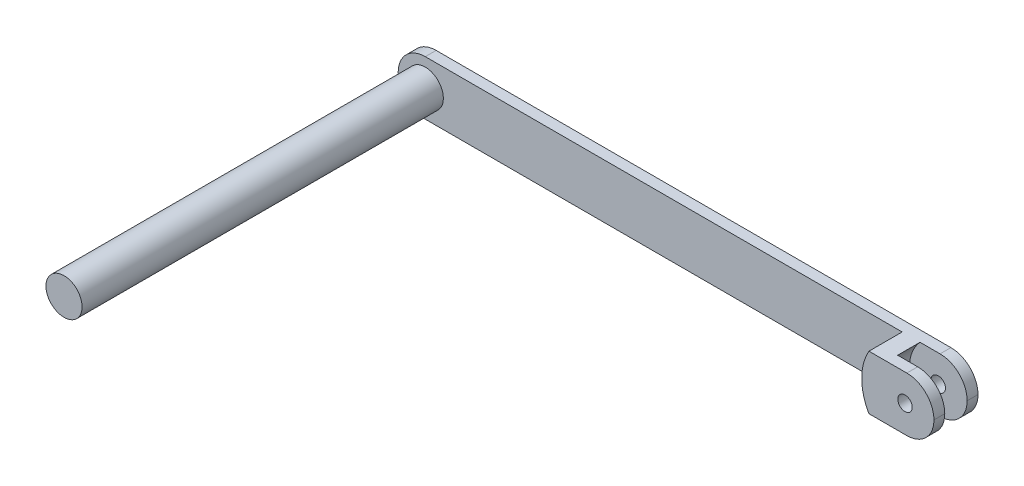
from build123d import *

# Parameters (mm, degrees)
BOSS_EXTRUDE1_DEPTH      = 3
SKETCH2_R                = 5
BOSS_EXTRUDE2_DEPTH      = 8
SKETCH3_R                = 5
BOSS_EXTRUDE3_DEPTH      = 92
BOSS_EXTRUDE6_DEPTH      = 9.2
BOSS_EXTRUDE7_REACH      = 190.339
BOSS_EXTRUDE7_END_RADIUS = 11
SKETCH8_W                = 3
SKETCH8_H                = 15
SKETCH9_R                = 2
CUT_EXTRUDE2_DEPTH       = 176.501823352
FILLET2_R                = 7.5


with BuildPart() as part:
    # Sketch1 → Boss-Extrude1 (new body)
    with BuildSketch(Plane.XY):
        with BuildLine():
            Line((0, 7.5), (150, 7.5))
            Line((150, 7.5), (150, -7.5))
            Line((150, -7.5), (0, -7.5))
            ThreePointArc((0, -7.5), (-7.5, 0), (0, 7.5))
        make_face()
    extrude(amount=BOSS_EXTRUDE1_DEPTH)

    # Sketch2 → Boss-Extrude2 (add)
    with BuildSketch(Plane.XY.offset(3)):
        Circle(SKETCH2_R)
    extrude(amount=BOSS_EXTRUDE2_DEPTH)

    # Sketch3 → Boss-Extrude3 (add)
    with BuildSketch(Plane.XY.offset(11)):
        Circle(SKETCH3_R)
    extrude(amount=BOSS_EXTRUDE3_DEPTH)

    # Sketch7 → Boss-Extrude6 (add)
    with BuildSketch(Plane.XY.offset(3)):
        with BuildLine():
            Line((136.95326153, 7.5), (132.009618943, 7.5))
            ThreePointArc((132.009618943, 7.5), (130, 0), (132.009618943, -7.5))
            Line((132.009618943, -7.5), (136.95326153, -7.5))
            ThreePointArc((136.95326153, -7.5), (134, 0), (136.95326153, 7.5))
        make_face()
    extrude(amount=BOSS_EXTRUDE6_DEPTH)

    # Boss-Extrude7: up to this cylinder (the profile starts inside it)
    boss_extrude7_end = Plane(origin=(145, 0, 10.7), z_dir=(0, 0, -1)) * Cylinder(BOSS_EXTRUDE7_END_RADIUS, 403.678, mode=Mode.PRIVATE)
    # Sketch8 → Boss-Extrude7 (add, up to the surface)
    with BuildSketch(Plane(origin=(150, 0, 0), x_dir=(0, 0, -1), z_dir=(1, 0, 0)), mode=Mode.PRIVATE) as boss_extrude7_sk1:
        with Locations((-10.7, 0)):
            Rectangle(SKETCH8_W, SKETCH8_H)
    boss_extrude7_tool1 = extrude(boss_extrude7_sk1.sketch, amount=-BOSS_EXTRUDE7_REACH, mode=Mode.PRIVATE) & boss_extrude7_end
    add(boss_extrude7_tool1.solids().sort_by_distance((150, 0, 10.7))[0])

    # Sketch9 → Cut-Extrude2 (cut, through all)
    with BuildSketch(Plane.XY.offset(12.2)):
        with Locations((142, 0)):
            Circle(SKETCH9_R)
    extrude(amount=-CUT_EXTRUDE2_DEPTH, mode=Mode.SUBTRACT)

    # Fillet2
    fillet2_edges = [part.edges().sort_by_distance(p)[0] for p in [
        (150, -7.5, 1.5),
        (150, -7.5, 10.7),
        (150, 7.5, 1.5),
        (150, 7.5, 10.7),
    ]]
    fillet(fillet2_edges, radius=FILLET2_R - 0.0001)  # a hair under: the kernel refuses the full size


solid = part.part
